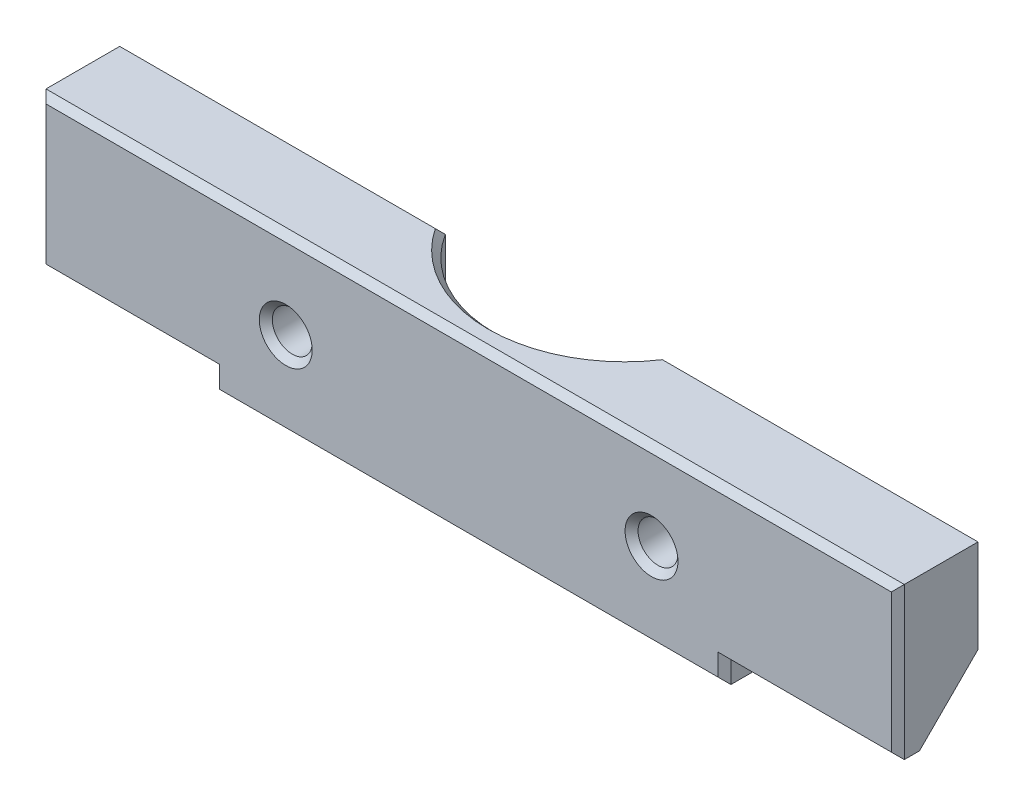
from build123d import *

# Parameters (mm, degrees)
SKIZZE1_W                       = 59
SKIZZE1_H                       = 20
AUFSATZ_LINEAR_AUSTRAGEN1_DEPTH = 10
AUFSATZ_LINEAR_AUSTRAGEN2_DEPTH = 20
SKIZZE3_R                       = 15
SCHNITT_LINEAR_AUSTRAGEN1_DEPTH = 20
SKIZZE4_R                       = 2.3
SCHNITT_LINEAR_AUSTRAGEN2_DEPTH = 20
SKIZZE5_R                       = 3.75
SCHNITT_LINEAR_AUSTRAGEN3_DEPTH = 3
SCHNITT_LINEAR_AUSTRAGEN4_DEPTH = 20
FASE3_SIZE                      = 0.75


with BuildPart() as part:
    # Skizze1 → Aufsatz-Linear austragen1 (new body)
    with BuildSketch(Plane.XY):
        with Locations((0, 10)):
            Rectangle(SKIZZE1_W, SKIZZE1_H)
    extrude(amount=AUFSATZ_LINEAR_AUSTRAGEN1_DEPTH)

    # Skizze2 → Aufsatz-Linear austragen2 (add)
    with BuildSketch(Plane.ZY.offset(29.5)):
        Polygon((10, 0), (0, 10), (0, 20), (10, 20), align=None)
    aufsatz_linear_austragen2 = extrude(amount=AUFSATZ_LINEAR_AUSTRAGEN2_DEPTH)

    # Spiegeln1: Aufsatz-Linear austragen2 across plane
    add(aufsatz_linear_austragen2.mirror(Plane(origin=(0, 0, 0), x_dir=(0, 0, 1), z_dir=(1, 0, 0))))

    # Skizze3 → Schnitt-Linear austragen1 (cut)
    with BuildSketch(Plane.XZ):
        with Locations((0, -8)):
            Circle(SKIZZE3_R)
    extrude(amount=-SCHNITT_LINEAR_AUSTRAGEN1_DEPTH, mode=Mode.SUBTRACT)

    # Skizze4 → Schnitt-Linear austragen2 (cut)
    with BuildSketch(Plane(origin=(0, 0, 0), x_dir=(-1, 0, 0), z_dir=(0, 0, -1))):
        with Locations((-21.09428877, 10)):
            Circle(SKIZZE4_R)
        with Locations((21.09428877, 10)):
            Circle(SKIZZE4_R)
    extrude(amount=-SCHNITT_LINEAR_AUSTRAGEN2_DEPTH, mode=Mode.SUBTRACT)

    # Skizze5 → Schnitt-Linear austragen3 (cut)
    with BuildSketch(Plane(origin=(0, 0, 0), x_dir=(-1, 0, 0), z_dir=(0, 0, -1))):
        with Locations((-21.09428877, 10)):
            Circle(SKIZZE5_R)
        with Locations((21.09428877, 10)):
            Circle(SKIZZE5_R)
    extrude(amount=-SCHNITT_LINEAR_AUSTRAGEN3_DEPTH, mode=Mode.SUBTRACT)

    # Skizze6 → Schnitt-Linear austragen4 (cut)
    with BuildSketch(Plane.ZY.offset(49.5)):
        Polygon((10, 2.5), (4.852604626, 2.5), (4.852604626, -2.668604054), (13.586779437, -2.788104879), (13.586779437, 2.151024835), align=None)
    schnitt_linear_austragen4 = extrude(amount=-SCHNITT_LINEAR_AUSTRAGEN4_DEPTH, mode=Mode.SUBTRACT)

    # Spiegeln3: Schnitt-Linear austragen4 across plane
    add(schnitt_linear_austragen4.mirror(Plane(origin=(0, 0, 0), x_dir=(0, 0, 1), z_dir=(1, 0, 0))), mode=Mode.SUBTRACT)

    # Fase3
    fase3_edges = [part.edges().sort_by_distance(p)[0] for p in [
        (0, 0, 10),
        (-29.5, 1.25, 10),
        (-39.5, 2.5, 10),
        (-49.5, 11.25, 10),
        (0, 20, 10),
        (49.5, 11.25, 10),
        (39.5, 2.5, 10),
        (29.5, 1.25, 10),
        (-18.79428877, 10, 10),
        (23.39428877, 10, 10),
        (-17.34428877, 10, 0),
        (24.84428877, 10, 0),
        (49.5, 15, 0),
        (31.09428877, 20, 0),
        (0, 20, 7),
        (-31.09428877, 20, 0),
        (-49.5, 15, 0),
        (29.5, 5, 0),
        (21.09428877, 0, 0),
        (0, 0, 7),
        (-29.5, 5, 0),
        (-21.09428877, 0, 0),
    ]]
    chamfer(fase3_edges, length=FASE3_SIZE)


solid = part.part
